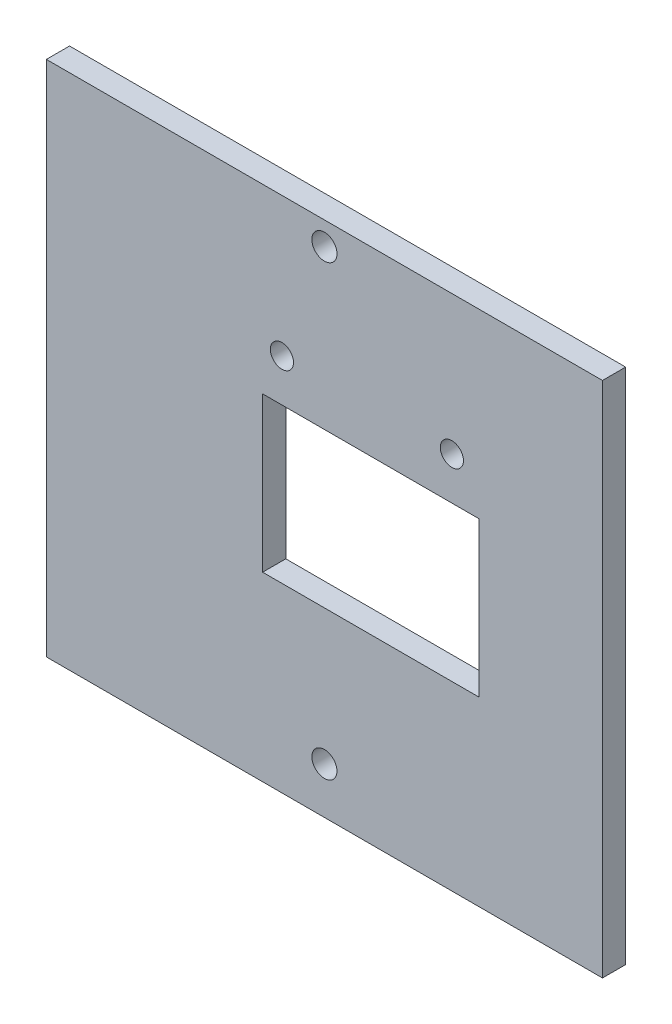
from build123d import *

# Parameters (mm, degrees)
CROQUIS1_W              = 72
CROQUIS1_H              = 67
SALIENTE_EXTRUIR1_DEPTH = 3
CROQUIS4_R              = 1.625
CROQUIS4_R_2            = 1.5
CORTAR_EXTRUIR2_DEPTH   = 3


with BuildPart() as part:
    # Croquis1 → Saliente-Extruir1 (new body)
    with BuildSketch(Plane.XY):
        with Locations((83.049688553, -19.639954107)):
            Rectangle(CROQUIS1_W, CROQUIS1_H)
    extrude(amount=SALIENTE_EXTRUIR1_DEPTH)

    # Croquis4 → Cortar-Extruir2 (cut)
    with BuildSketch(Plane(origin=(0, 0, 0), x_dir=(-1, 0, 0), z_dir=(0, 0, -1))):
        with Locations((-83.049688553, -47.139954107)):
            Circle(CROQUIS4_R)
        with Locations((-83.049688553, 10.860045893)):
            Circle(CROQUIS4_R)
        with Locations((-99.549688553, -4.139954107)):
            Circle(CROQUIS4_R_2)
        with Locations((-77.549688553, -4.139954107)):
            Circle(CROQUIS4_R_2)
        Polygon((-78.049688553, -9.639954107), (-75.049688553, -9.639954107), (-75.049688553, -29.639954107), (-78.049688553, -29.639954107), (-103.049688553, -29.639954107), (-103.049688553, -9.639954107), align=None)
    extrude(amount=-CORTAR_EXTRUIR2_DEPTH, mode=Mode.SUBTRACT)


solid = part.part
